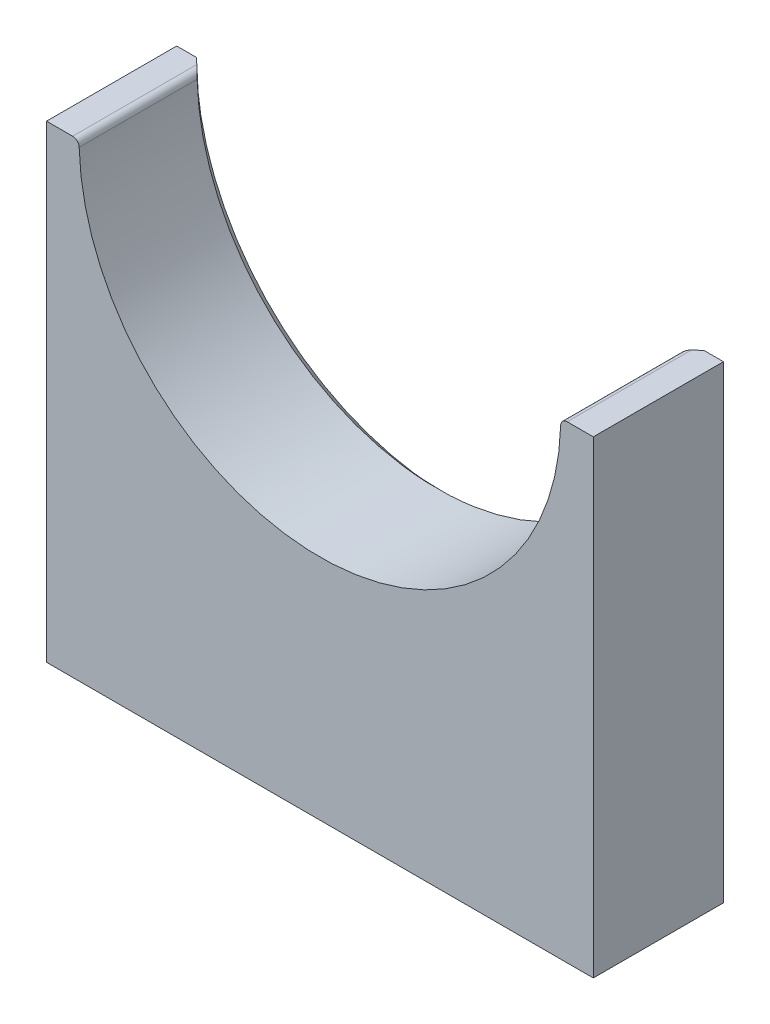
from build123d import *

# Parameters (mm, degrees)
SKETCH2_W           = 213.36
SKETCH2_H           = 213.36
SKETCH2_R           = 93.98
BOSS_EXTRUDE1_DEPTH = 50.8
SKETCH4_W           = 431.498092941
SKETCH4_H           = 427.351859682
CUT_EXTRUDE1_DEPTH  = 106.68
FILLET1_R           = 2.54
SKETCH6_W           = 213.36
SKETCH6_H           = 50.8
BOSS_EXTRUDE3_DEPTH = 76.2


with BuildPart() as part:
    # Sketch2 → Boss-Extrude1 (new body)
    with BuildSketch(Plane.XY.offset(50.8)):
        Rectangle(SKETCH2_W, SKETCH2_H)
        Circle(SKETCH2_R, mode=Mode.SUBTRACT)
    extrude(amount=-BOSS_EXTRUDE1_DEPTH)

    # Cut-Loft1: read off the stored shape, not the designer's step
    # Cut-Loft1: loft between two sections, ruled curve by curve
    cut_loft1_from = [
        Edge.make_bspline([(-5.225836659, 98.922061398, 0), (-203.069959455, 88.47038808, 0), (-192.618286137, -109.373734716, 0), (5.225836659, -98.922061398, 0), (203.069959455, -88.47038808, 0), (192.618286137, 109.373734716, 0), (-5.225836659, 98.922061398, 0)], [0, 0, 0, 0, 0.5, 0.5, 0.5, 1, 1, 1, 1], 3, [1, 0.333333333, 0.333333333, 1, 0.333333333, 0.333333333, 1]),
    ]
    cut_loft1_to = [
        Edge.make_bspline([(82.069205503, 45.791766816, 50.8), (-9.514328128, 209.930177822, 50.8), (-173.652739134, 118.34664419, 50.8), (-82.069205503, -45.791766816, 50.8), (9.514328128, -209.930177822, 50.8), (173.652739134, -118.34664419, 50.8), (82.069205503, 45.791766816, 50.8)], [0, 0, 0, 0, 0.5, 0.5, 0.5, 1, 1, 1, 1], 3, [1, 0.333333333, 0.333333333, 1, 0.333333333, 0.333333333, 1]),
    ]
    cut_loft1 = Solid(Shell([*[Face.make_surface_from_curves(cut_loft1_from[k], cut_loft1_to[k]) for k in range(1)], Face(Wire(cut_loft1_from)), Face(Wire(cut_loft1_to))]))
    add(cut_loft1, mode=Mode.SUBTRACT)

    # Sketch4 → Cut-Extrude1 (cut)
    with BuildSketch(Plane(origin=(0, 106.68, 0), x_dir=(1, 0, 0), z_dir=(0, 1, 0))):
        with Locations((-43.743226098, -53.764043901)):
            Rectangle(SKETCH4_W, SKETCH4_H)
    extrude(amount=-CUT_EXTRUDE1_DEPTH, mode=Mode.SUBTRACT)

    # Fillet1
    fillet1_edges = [part.edges().sort_by_distance(p)[0] for p in [
        (93.98, 0, 27.785112978),
        (-93.98, 0, 27.785112678),
    ]]
    fillet(fillet1_edges, radius=FILLET1_R)

    # Sketch6 → Boss-Extrude3 (add)
    with BuildSketch(Plane(origin=(0, -106.68, 0), x_dir=(-1, 0, 0), z_dir=(0, -1, 0))):
        with Locations((0, -25.4)):
            Rectangle(SKETCH6_W, SKETCH6_H)
    extrude(amount=BOSS_EXTRUDE3_DEPTH)


solid = part.part
